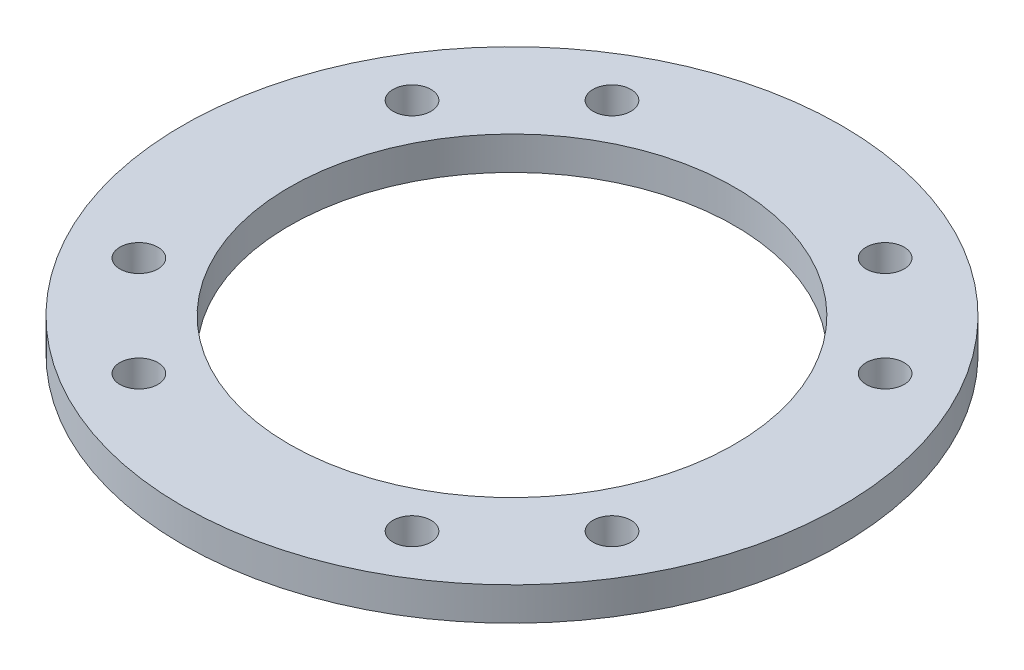
from build123d import *

# Parameters (mm, degrees)
STOCK_BATTERYPLATE_1_START       = -46.25
STOCK_BATTERYPLATE_1_OUTLINE_R   = 55.5
STOCK_BATTERYPLATE_1_OUTLINE_R_2 = 3.2
STOCK_BATTERYPLATE_1_OUTLINE_R_3 = 3.175
STOCK_BATTERYPLATE_1_DEPTH       = 5.60286881
CUT_EXTRUDE1_REACH               = 80.689
SKETCH1_R                        = 37.5


# Read off the part's stored shape, not the designer's step: Stock-batteryplate-1
with BuildPart() as part:
    # Stock-batteryplate-1 outline → Stock-batteryplate-1 (new body)
    with BuildSketch(Plane(origin=(0, 0, 0), x_dir=(1, 0, 0), z_dir=(0, 1, 0)).offset(STOCK_BATTERYPLATE_1_START)):
        Circle(STOCK_BATTERYPLATE_1_OUTLINE_R)
        with Locations((-23, -39.837168574)):
            Circle(STOCK_BATTERYPLATE_1_OUTLINE_R_2, mode=Mode.SUBTRACT)
        with Locations((-39.837168574, -23)):
            Circle(STOCK_BATTERYPLATE_1_OUTLINE_R_2, mode=Mode.SUBTRACT)
        with Locations((-14.849242405, -14.849242405)):
            Circle(STOCK_BATTERYPLATE_1_OUTLINE_R_2, mode=Mode.SUBTRACT)
        with Locations((23, -39.837168574)):
            Circle(STOCK_BATTERYPLATE_1_OUTLINE_R_2, mode=Mode.SUBTRACT)
        with Locations((14.849242405, -14.849242405)):
            Circle(STOCK_BATTERYPLATE_1_OUTLINE_R_2, mode=Mode.SUBTRACT)
        with Locations((39.837168574, -23)):
            Circle(STOCK_BATTERYPLATE_1_OUTLINE_R_2, mode=Mode.SUBTRACT)
        with Locations((-39.837168574, 23)):
            Circle(STOCK_BATTERYPLATE_1_OUTLINE_R_2, mode=Mode.SUBTRACT)
        with Locations((-14.849242405, 14.849242405)):
            Circle(STOCK_BATTERYPLATE_1_OUTLINE_R_2, mode=Mode.SUBTRACT)
        with Locations((-23, 39.837168574)):
            Circle(STOCK_BATTERYPLATE_1_OUTLINE_R_2, mode=Mode.SUBTRACT)
        Circle(STOCK_BATTERYPLATE_1_OUTLINE_R_3, mode=Mode.SUBTRACT)
        with Locations((14.849242405, 14.849242405)):
            Circle(STOCK_BATTERYPLATE_1_OUTLINE_R_2, mode=Mode.SUBTRACT)
        with Locations((39.837168574, 23)):
            Circle(STOCK_BATTERYPLATE_1_OUTLINE_R_2, mode=Mode.SUBTRACT)
        with Locations((23, 39.837168574)):
            Circle(STOCK_BATTERYPLATE_1_OUTLINE_R_2, mode=Mode.SUBTRACT)
    extrude(amount=STOCK_BATTERYPLATE_1_DEPTH)

    # Sketch1 → Cut-Extrude1 (cut, up to next)
    with BuildSketch(Plane(origin=(0, -40.64713119, 0), x_dir=(1, 0, 0), z_dir=(0, 1, 0)), mode=Mode.PRIVATE) as cut_extrude1_sk1:
        with Locations(Location((0, 0, 0), (0, 0, 270))):
            Circle(SKETCH1_R)
    cut_extrude1_tool1 = extrude(cut_extrude1_sk1.sketch, amount=-CUT_EXTRUDE1_REACH, mode=Mode.PRIVATE) & part.part
    add(cut_extrude1_tool1.solids().sort_by_distance((0, -40.647131, 0))[0], mode=Mode.SUBTRACT)


solid = part.part
